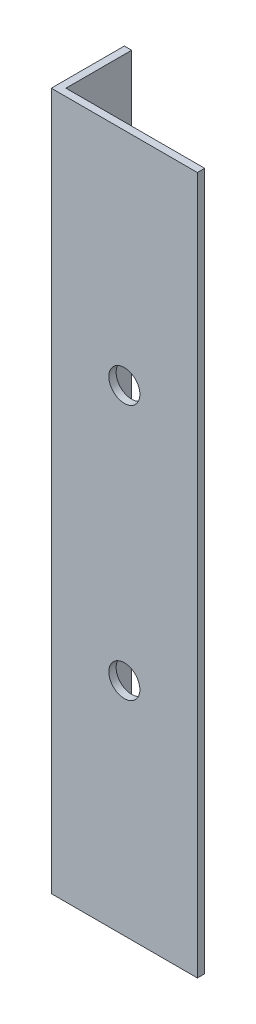
from build123d import *

# Parameters (mm, degrees)
EXTRUDE_1_DEPTH     = 191
SKETCH_2_R          = 4.25
CUT_EXTRUDE_1_DEPTH = 197.165746245


with BuildPart() as part:
    # Эскиз1 → Бобышка-Вытянуть1 (new body)
    with BuildSketch(Plane(origin=(0, 0, 0), x_dir=(1, 0, 0), z_dir=(0, 1, 0))):
        Polygon((0, 0), (0, 20), (2, 20), (2, 2), (40, 2), (40, 0), align=None)
    extrude(amount=EXTRUDE_1_DEPTH)

    # Эскиз2 → Вырез-Вытянуть1 (cut, through all)
    with BuildSketch(Plane.XY):
        with Locations((20, 130.5)):
            Circle(SKETCH_2_R)
        with Locations((20, 60.5)):
            Circle(SKETCH_2_R)
    extrude(amount=-CUT_EXTRUDE_1_DEPTH, mode=Mode.SUBTRACT)


solid = part.part
